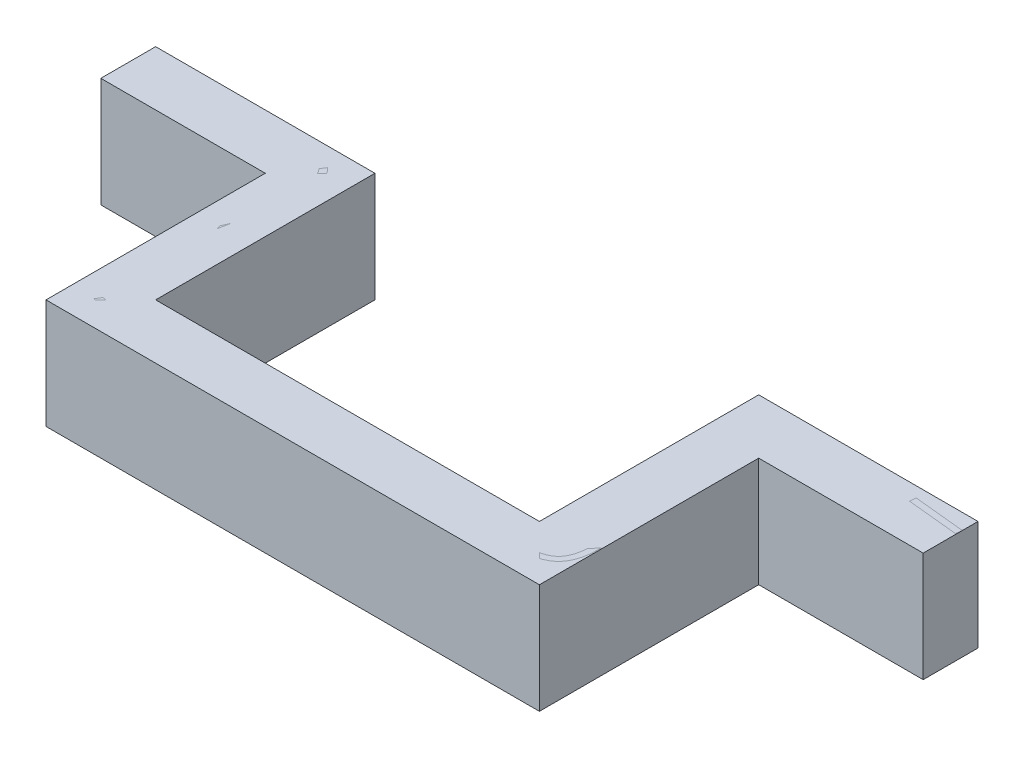
from build123d import *

# Parameters (mm, degrees)
BOSS_EXTRUDE1_DEPTH = 20
SWEEP2_START        = 0.374747252
SWEEP2_DEPTH        = 19.625252748


# Read off the part's stored shape, not the designer's step: Sweep2
with BuildPart() as part:
    # Sketch2 → Boss-Extrude1 (new body)
    with BuildSketch(Plane(origin=(0, 0, 0), x_dir=(1, 0, 0), z_dir=(0, 1, 0))):
        Polygon((-10, 10), (0, 10), (0, 0), (0, -30), (70, -30), (70, 0), (70, 10), (80, 10), (110, 10), (110, 0), (80, 0), (80, -40), (-10, -40), (-10, 0), (-40, 0), (-40, 10), align=None)
    extrude(amount=BOSS_EXTRUDE1_DEPTH)


with BuildPart() as body_2:
    # Sweep2 outline → Sweep2 (new body)
    with BuildSketch(Plane(origin=(0, 0, 0), x_dir=(1, 0, 0), z_dir=(0, 1, 0)).offset(SWEEP2_START)):
        with BuildLine():
            Line((109.864622559, 6.022884744), (110, 7.137672854))
            add(Edge.make_bspline(
                [(110, 7.137672854), (101.496960936, 8.082327125), (95.01003051, 8.590508145), (85.108473856, 8.904380191), (81.693847634, 8.710071216), (78.156201636, 8.01958264), (77.241035201, 7.722915594), (75.818810961, 7.017880197), (75.311753179, 6.609511842), (74.585757094, 5.702380892), (74.366818829, 5.203618291), (74.097072636, 4.137005914), (74.046264747, 3.569156132), (73.890910832, 0.130919376), (74.319283899, -3.268389015), (75.608441857, -10.420092574), (76.469226768, -14.172487749), (77.941640962, -21.27782873), (78.553270252, -24.630774543), (78.772671855, -28.796204122), (78.729465338, -30.040682463), (78.325175587, -32.14757574), (77.964092358, -33.009990682), (77.058644906, -34.01478313), (76.640986958, -34.306832691), (75.680316621, -34.750243358), (75.137304224, -34.901604453), (73.356693834, -35.198801808), (71.96752262, -35.187752107), (68.97943011, -35.036072865), (67.391193816, -34.913269658), (64.135909735, -34.720914884), (62.457866398, -34.633018884), (53.868055917, -34.233338505), (46.35750737, -34.040952987), (23.922408155, -33.784151882), (9.094403898, -34.040091756), (-1.8407237, -34.647639682), (-3.281498309, -34.744441998), (-5.056974314, -34.494146717), (-5.58451867, -34.344798514), (-6.487298348, -33.846416279), (-6.862533677, -33.497382271), (-7.593512805, -32.268586219), (-7.827124859, -31.203230098), (-7.979364454, -28.592386721), (-7.897991991, -27.046899457), (-7.339400418, -21.928134537), (-6.547707112, -17.872553733), (-4.968403118, -9.744016157), (-4.180792422, -5.671059377), (-3.63444868, -0.500166527), (-3.55817948, 1.067040708), (-3.722666906, 3.730012015), (-3.963423529, 4.825776093), (-4.803614415, 6.277249301), (-5.347726308, 6.715483227), (-6.601653923, 7.296853472), (-7.311469675, 7.439989756), (-8.750792741, 7.601056343), (-9.473669606, 7.625748334), (-10.826839975, 7.685412817), (-11.469319388, 7.707958183), (-14.558421459, 7.788554794), (-16.635159082, 7.750215364), (-23.495519247, 7.492026177), (-28.90928901, 7.129005519), (-40, 7.015834998)],
                knots=[0, 0, 0, 0, 0.013345821, 0.013345821, 0.026691642, 0.026691642, 0.033364553, 0.033364553, 0.040037464, 0.040037464, 0.046710374, 0.046710374, 0.053383285, 0.053383285, 0.085482559, 0.085482559, 0.117581834, 0.117581834, 0.149681108, 0.149681108, 0.165730745, 0.165730745, 0.181780382, 0.181780382, 0.191560106, 0.191560106, 0.201339829, 0.201339829, 0.220899275, 0.220899275, 0.240458721, 0.240458721, 0.260018167, 0.260018167, 0.338255952, 0.338255952, 0.494731522, 0.494731522, 0.521607911, 0.521607911, 0.535046105, 0.535046105, 0.5484843, 0.5484843, 0.569248022, 0.569248022, 0.590011744, 0.590011744, 0.631539189, 0.631539189, 0.673066633, 0.673066633, 0.693830355, 0.693830355, 0.714594078, 0.714594078, 0.732431948, 0.732431948, 0.750269818, 0.750269818, 0.768107688, 0.768107688, 0.785945558, 0.785945558, 0.857297039, 0.857297039, 1, 1, 1, 1], degree=3))
            Line((-40, 7.015834998), (-40, 5.892857001))
            add(Edge.make_bspline(
                [(109.864622559, 6.022884744), (101.380537573, 6.965243575), (94.917334736, 7.470429549), (85.107108709, 7.780473298), (81.75573336, 7.579542057), (78.431062962, 6.928371183), (77.610035481, 6.654026336), (76.426764363, 6.064424323), (76.066560743, 5.758495357), (75.570061038, 5.132197358), (75.421424326, 4.798798566), (75.214138594, 3.968971889), (75.165765051, 3.475307142), (75.020622861, 0.221351575), (75.432682226, -3.117320774), (76.709326494, -10.195302752), (77.56786787, -13.939357222), (79.046767305, -21.077684082), (79.670278321, -24.466302279), (79.897119506, -28.807007153), (79.85671293, -30.132150527), (79.399208825, -32.501844186), (78.976991237, -33.567585282), (77.771597295, -34.898480751), (77.217525519, -35.278919581), (76.024150646, -35.826871342), (75.384496062, -35.999570498), (73.383003424, -36.331322026), (71.928817795, -36.310456378), (68.881392718, -36.155158034), (67.308369018, -36.033201027), (64.063382131, -35.841560218), (62.389965815, -35.753950335), (53.821465753, -35.355479549), (46.322547826, -35.16343723), (23.919396777, -34.907327899), (9.099922287, -35.163972743), (-1.782085361, -35.769112767), (-3.265695097, -35.882609284), (-5.317023295, -35.590551219), (-5.980258587, -35.411099523), (-7.197030638, -34.735172694), (-7.737015219, -34.227592626), (-8.713465886, -32.576401902), (-8.944100292, -31.355060686), (-9.10575377, -28.548412211), (-9.017530686, -26.95127013), (-8.445471454, -21.719770556), (-7.647695562, -17.646488629), (-6.06865732, -9.519248031), (-5.287451369, -5.465454055), (-4.754368771, -0.408894565), (-4.684658451, 1.106063427), (-4.839167756, 3.575404466), (-5.080093944, 4.519173114), (-5.661710614, 5.513244398), (-5.995473987, 5.780118812), (-6.919361774, 6.204358437), (-7.512704879, 6.333252271), (-8.822092408, 6.478434487), (-9.540958205, 6.504769915), (-10.881374096, 6.563741563), (-11.517059417, 6.585973555), (-14.571172205, 6.665299901), (-16.617390737, 6.62730249), (-23.438713398, 6.370183725), (-28.891690327, 6.005995184), (-40, 5.892857001)],
                knots=[0, 0, 0, 0, 0.013345821, 0.013345821, 0.026691642, 0.026691642, 0.033364553, 0.033364553, 0.040037464, 0.040037464, 0.046710374, 0.046710374, 0.053383285, 0.053383285, 0.085482559, 0.085482559, 0.117581834, 0.117581834, 0.149681108, 0.149681108, 0.165730745, 0.165730745, 0.181780382, 0.181780382, 0.191560106, 0.191560106, 0.201339829, 0.201339829, 0.220899275, 0.220899275, 0.240458721, 0.240458721, 0.260018167, 0.260018167, 0.338255952, 0.338255952, 0.494731522, 0.494731522, 0.521607911, 0.521607911, 0.535046105, 0.535046105, 0.5484843, 0.5484843, 0.569248022, 0.569248022, 0.590011744, 0.590011744, 0.631539189, 0.631539189, 0.673066633, 0.673066633, 0.693830355, 0.693830355, 0.714594078, 0.714594078, 0.732431948, 0.732431948, 0.750269818, 0.750269818, 0.768107688, 0.768107688, 0.785945558, 0.785945558, 0.857297039, 0.857297039, 1, 1, 1, 1], degree=3))
        make_face()
    extrude(amount=SWEEP2_DEPTH)


solid = Compound([part.part, body_2.part])
